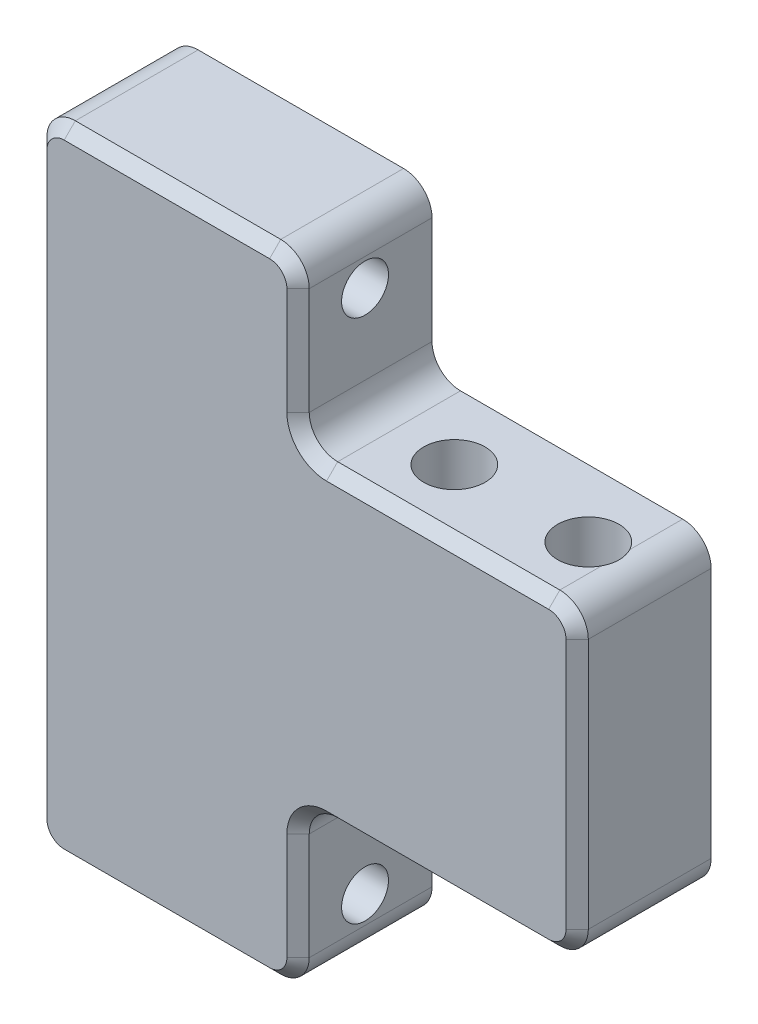
from build123d import *

# Parameters (mm, degrees)
BOSS_EXTRUDE1_DEPTH      = 12
SKETCH2_R                = 2.1
CUT_EXTRUDE1_DEPTH       = 82.983229992
M5_CLEARANCE_HOLE1_D     = 5.5
M5_CLEARANCE_HOLE1_DEPTH = 28.347633298
M5_CLEARANCE_HOLE1_TIP   = 1.652366702
FILLET1_R                = 2.55
CHAMFER1_SIZE            = 1


with BuildPart() as part:
    # Sketch1 → Boss-Extrude1 (new body)
    with BuildSketch(Plane.XY):
        Polygon((10, 65), (10, 8), (33.5, 8), (33.5, 22.7), (58.5, 22.7), (58.5, 50.3), (33.5, 50.3), (33.5, 65), align=None)
    extrude(amount=-BOSS_EXTRUDE1_DEPTH)

    # Sketch2 → Cut-Extrude1 (cut, through all)
    with BuildSketch(Plane.ZY.offset(-10)):
        with Locations((-6, 13)):
            Circle(SKETCH2_R)
        with Locations((-6, 60)):
            Circle(SKETCH2_R)
    extrude(amount=-CUT_EXTRUDE1_DEPTH, mode=Mode.SUBTRACT)

    # M5 Clearance Hole1
    with Locations(Plane(origin=(0, 22.7, 0), x_dir=(-1, 0, 0), z_dir=(0, -1, 0))):
        with Locations((-53.5, 6), (-41.5, 6)):
            Hole(M5_CLEARANCE_HOLE1_D / 2, depth=M5_CLEARANCE_HOLE1_DEPTH)
            with Locations((0, 0, -(M5_CLEARANCE_HOLE1_DEPTH + M5_CLEARANCE_HOLE1_TIP / 2))):  # 118° drill point
                Cone(0, M5_CLEARANCE_HOLE1_D / 2, M5_CLEARANCE_HOLE1_TIP, mode=Mode.SUBTRACT)

    # Fillet1
    # the kernel refuses this fillet: 2.55 mm, written as the material it adds along each edge
    with BuildSketch(Plane(origin=(33.5, 50.3, 0), x_dir=(0, 1, 0), z_dir=(0, 0, -1))) as fillet1_piece_1:
        with BuildLine():
            CenterArc((FILLET1_R, FILLET1_R), FILLET1_R, 180, 90)
            Line((0, FILLET1_R), (0, 0))
            Line((0, 0), (FILLET1_R, 0))
        make_face()
    extrude(amount=12)
    with BuildSketch(Plane(origin=(33.5, 22.7, 0), x_dir=(0, -1, 0), z_dir=(0, 0, -1))) as fillet1_piece_2:
        with BuildLine():
            CenterArc((FILLET1_R, -FILLET1_R), FILLET1_R, 90, 90)
            Line((0, -FILLET1_R), (0, 0))
            Line((0, 0), (FILLET1_R, 0))
        make_face()
    extrude(amount=12)
    # the kernel refuses this fillet: 2.55 mm, written as the material it takes off along each edge
    with BuildSketch(Plane(origin=(33.5, 65, 6.375), x_dir=(-1, 0, 0), z_dir=(0, 0, -1)), Plane(origin=(10, 65, 6.375), x_dir=(0, -1, 0), z_dir=(0, 0, -1))) as fillet1_2_piece_1:
        with BuildLine():
            CenterArc((FILLET1_R, -FILLET1_R), FILLET1_R, 90, 90)
            Line((0, -FILLET1_R), (0, 0))
            Line((0, 0), (FILLET1_R, 0))
        make_face()
    extrude(amount=24.75, mode=Mode.SUBTRACT)
    with BuildSketch(Plane(origin=(58.5, 50.3, 6.375), x_dir=(0, -1, 0), z_dir=(0, 0, -1)), Plane(origin=(58.5, 22.7, 6.375), x_dir=(-1, 0, 0), z_dir=(0, 0, -1)), Plane(origin=(33.5, 8, 6.375), x_dir=(-1, 0, 0), z_dir=(0, 0, -1)), Plane(origin=(10, 8, 6.375), x_dir=(0, 1, 0), z_dir=(0, 0, -1))) as fillet1_2_piece_2:
        with BuildLine():
            CenterArc((FILLET1_R, FILLET1_R), FILLET1_R, 180, 90)
            Line((0, FILLET1_R), (0, 0))
            Line((0, 0), (FILLET1_R, 0))
        make_face()
    extrude(amount=24.75, mode=Mode.SUBTRACT)

    # Chamfer1
    chamfer1_edges = [part.edges().sort_by_distance(p)[0] for p in [
        (58.5, 36.5, 0),
        (21.75, 65, 0),
        (10, 36.5, 0),
        (21.75, 8, 0),
        (33.5, 15.35, 0),
        (46, 22.7, 0),
        (46, 50.3, 0),
        (33.5, 57.65, 0),
        (57.753122292, 23.446877708, 0),
        (32.753122292, 8.746877708, 0),
        (10.746877708, 8.746877708, 0),
        (10.746877708, 64.253122292, 0),
        (32.753122292, 64.253122292, 0),
        (57.753122292, 49.553122292, 0),
        (34.246877708, 51.046877708, 0),
        (34.246877708, 21.953122292, 0),
    ]]
    chamfer(chamfer1_edges, length=CHAMFER1_SIZE)


solid = part.part
